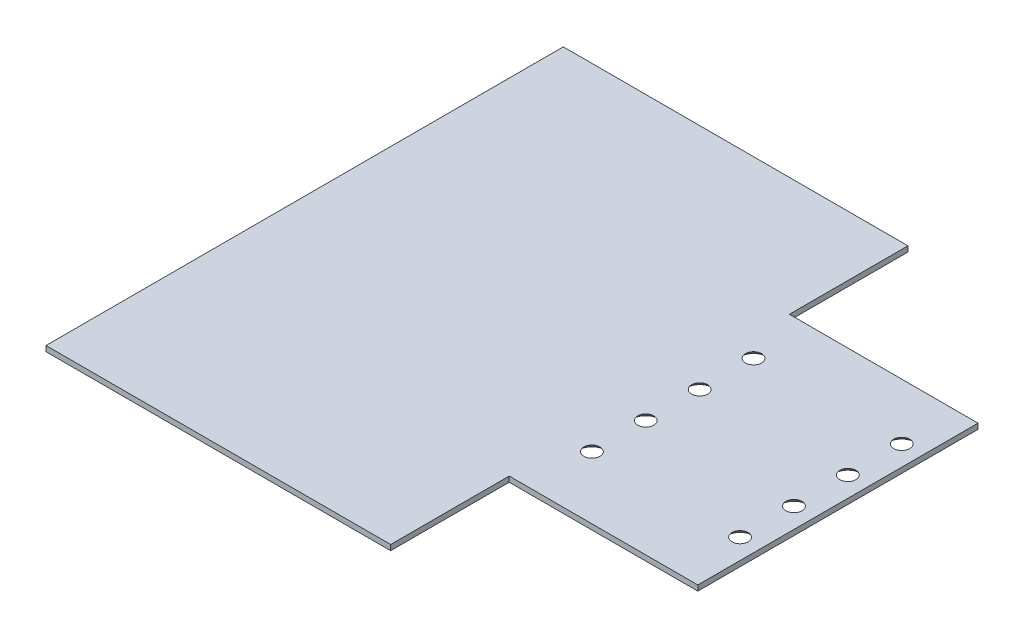
from build123d import *

# Parameters (mm, degrees)
EXTRUDE_1_DEPTH     = 1
SKETCH_2_R          = 1.5
CUT_EXTRUDE_1_DEPTH = 10
CHAMFER_1_SIZE      = 1


with BuildPart() as part:
    # Эскиз1 → Бобышка-Вытянуть1 (new body)
    with BuildSketch(Plane(origin=(0, 0, 0), x_dir=(1, 0, 0), z_dir=(0, 1, 0))):
        Polygon((15, -26), (15, -48), (-48.959081244, -48), (-48.959081244, 48), (15, 48), (15, 26), (50, 26), (50, -26), align=None)
    extrude(amount=EXTRUDE_1_DEPTH)

    # Эскиз2 → Вырез-Вытянуть1 (cut)
    with BuildSketch(Plane(origin=(0, 1, 0), x_dir=(1, 0, 0), z_dir=(0, 1, 0))):
        with Locations(Location((46.25, -14.4, 0), (0, 0, 270))):
            Circle(SKETCH_2_R)
        with Locations(Location((18.75, -14.4, 0), (0, 0, 270))):
            Circle(SKETCH_2_R)
        with Locations(Location((18.75, -4.4, 0), (0, 0, 270))):
            Circle(SKETCH_2_R)
        with Locations(Location((46.25, -4.4, 0), (0, 0, 270))):
            Circle(SKETCH_2_R)
        with Locations(Location((18.75, 5.6, 0), (0, 0, 270))):
            Circle(SKETCH_2_R)
        with Locations(Location((46.25, 5.6, 0), (0, 0, 270))):
            Circle(SKETCH_2_R)
        with Locations(Location((18.75, 15.6, 0), (0, 0, 270))):
            Circle(SKETCH_2_R)
        with Locations(Location((46.25, 15.6, 0), (0, 0, 270))):
            Circle(SKETCH_2_R)
    extrude(amount=-CUT_EXTRUDE_1_DEPTH, mode=Mode.SUBTRACT)

    # Фаска1
    chamfer_1_edges = [part.edges().sort_by_distance(p)[0] for p in [
        (46.25, 0, -7.1),
        (18.75, 0, 2.9),
        (46.25, 0, 2.9),
        (18.75, 0, 12.9),
        (18.75, 0, -17.1),
        (46.25, 0, -17.1),
        (18.75, 0, -7.1),
        (46.25, 0, 12.9),
    ]]
    chamfer(chamfer_1_edges, length=CHAMFER_1_SIZE - 0.0001)  # a hair under: the kernel refuses the full size


solid = part.part
